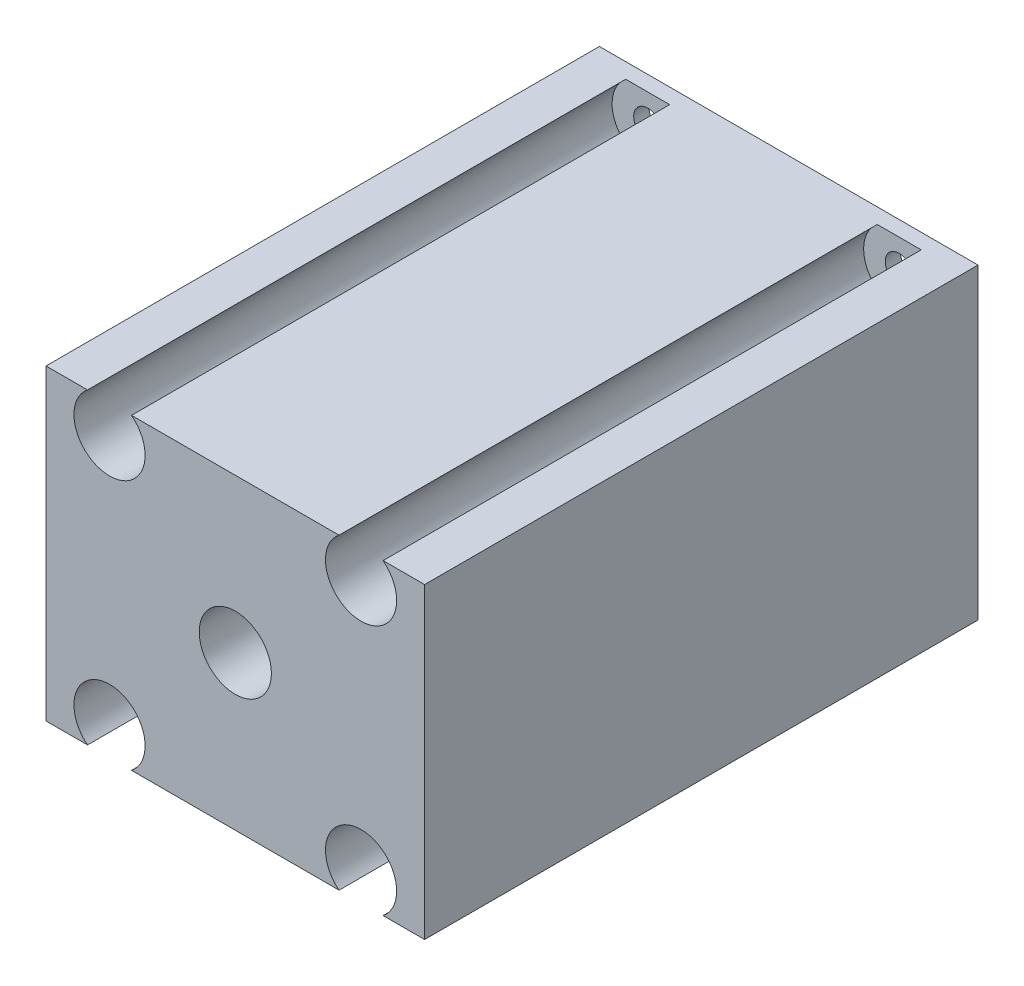
from build123d import *

# Parameters (mm, degrees)
SKETCH1_W                                     = 74.5
SKETCH1_H                                     = 60.5
SKETCH1_R                                     = 7.1
CONSERVATIVE_MANUFACTURER_CASE_ENVELOPE_DEPTH = 108.9
D50_PILOT_ENVELOPE_START                      = -2
SKETCH2_R                                     = 25
SKETCH2_R_2                                   = 7.1
D50_PILOT_ENVELOPE_DEPTH                      = 2
SKETCH3_R                                     = 2.75
BENCH_PCD70_FLANGE_HOLES_4X_D5P5_DEPTH        = 109.5
SKETCH4_R                                     = 7
BENCH_PCD70_FLANGE_BACK_RELIEF_4X_D14_DEPTH   = 105.9


with BuildPart() as part:
    # Sketch1 → Conservative_Manufacturer_Case_Envelope (new body)
    with BuildSketch(Plane.XY):
        Rectangle(SKETCH1_W, SKETCH1_H)
        Circle(SKETCH1_R, mode=Mode.SUBTRACT)
    extrude(amount=CONSERVATIVE_MANUFACTURER_CASE_ENVELOPE_DEPTH)

    # Sketch2 → D50_Pilot_Envelope (add)
    with BuildSketch(Plane.XY.offset(D50_PILOT_ENVELOPE_START)):
        Circle(SKETCH2_R)
        Circle(SKETCH2_R_2, mode=Mode.SUBTRACT)
    extrude(amount=D50_PILOT_ENVELOPE_DEPTH)

    # Sketch3 → Bench_PCD70_Flange_Holes_4x_D5p5 (cut)
    with BuildSketch(Plane.XY.offset(108.9)):
        with Locations((-24.748737342, -24.748737342)):
            Circle(SKETCH3_R)
        with Locations((-24.748737342, 24.748737342)):
            Circle(SKETCH3_R)
        with Locations((24.748737342, -24.748737342)):
            Circle(SKETCH3_R)
        with Locations((24.748737342, 24.748737342)):
            Circle(SKETCH3_R)
    extrude(amount=-BENCH_PCD70_FLANGE_HOLES_4X_D5P5_DEPTH, mode=Mode.SUBTRACT)

    # Sketch4 → Bench_PCD70_Flange_Back_Relief_4x_D14 (cut)
    with BuildSketch(Plane.XY.offset(108.9)):
        with Locations((-24.748737342, -24.748737342)):
            Circle(SKETCH4_R)
        with Locations((-24.748737342, 24.748737342)):
            Circle(SKETCH4_R)
        with Locations((24.748737342, -24.748737342)):
            Circle(SKETCH4_R)
        with Locations((24.748737342, 24.748737342)):
            Circle(SKETCH4_R)
    extrude(amount=-BENCH_PCD70_FLANGE_BACK_RELIEF_4X_D14_DEPTH, mode=Mode.SUBTRACT)


solid = part.part
